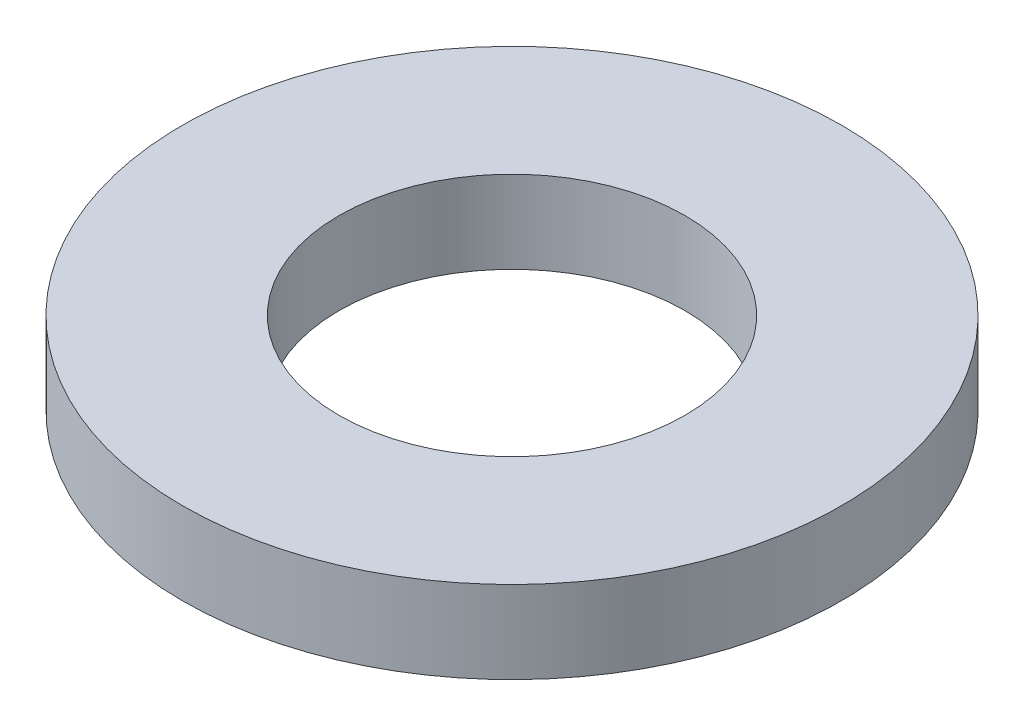
from build123d import *

# Parameters (mm, degrees)
SKETCH1_R           = 10.16
SKETCH1_R_2         = 5.334
BOSS_EXTRUDE1_DEPTH = 2.54


with BuildPart() as part:
    # Sketch1 → Boss-Extrude1 (new body)
    with BuildSketch(Plane(origin=(0, 0, 0), x_dir=(1, 0, 0), z_dir=(0, 1, 0))):
        Circle(SKETCH1_R)
        Circle(SKETCH1_R_2, mode=Mode.SUBTRACT)
    extrude(amount=BOSS_EXTRUDE1_DEPTH)


solid = part.part
